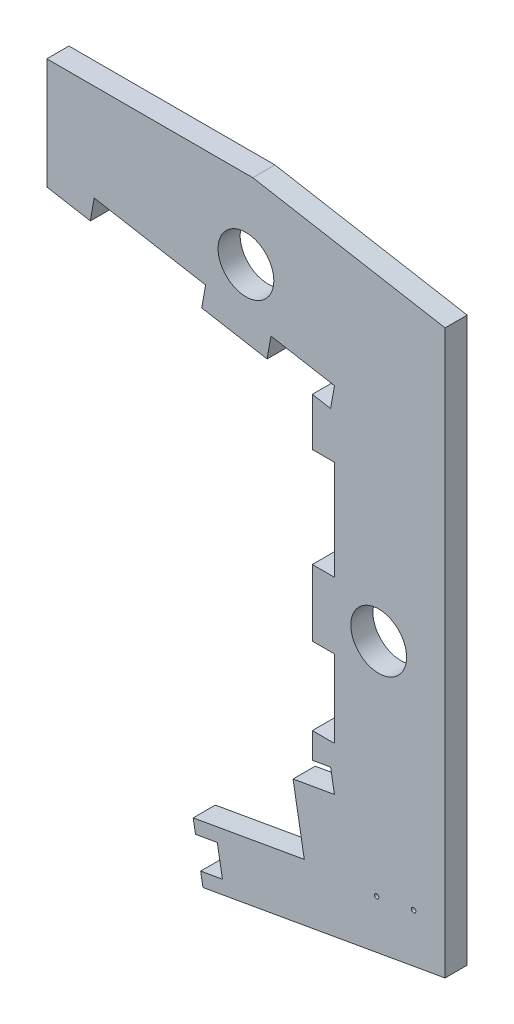
from build123d import *

# Parameters (mm, degrees)
ESQUISSE1_R             = 6.3
BOSS_EXTRU_1_DEPTH      = 5
ESQUISSE2_R             = 0.5
ENL_V_MAT_EXTRU_1_DEPTH = 5
ESQUISSE3_W             = 5
ESQUISSE3_H             = 15
BOSS_EXTRU_3_DEPTH      = 5


with BuildPart() as part:
    # Esquisse1 → Boss.-Extru.1 (new body)
    with BuildSketch(Plane.XY):
        Polygon((-65, 51.461253746), (0, 40), (0, -40), (-9.359100785, -41.650261983), (-6.809077296, -56.112163836), (-31.918247866, -60.539588071), (-29.710027076, -73.063030491), (25, -63.416176602), (25, 63.800831685), (-18.444412366, 71.461253746), (-65, 71.461253746), align=None)
        with Locations((-20, 53.680805733)):
            Circle(ESQUISSE1_R, mode=Mode.SUBTRACT)
        with Locations((10, -5)):
            Circle(ESQUISSE1_R, mode=Mode.SUBTRACT)
    extrude(amount=BOSS_EXTRU_1_DEPTH)

    # Esquisse2 → Enlèv. mat.-Extru.1 (cut)
    with BuildSketch(Plane(origin=(0, 0, 0), x_dir=(-1, 0, 0), z_dir=(0, 0, -1))):
        with Locations((-9.52419964, -55.169092692)):
            Circle(ESQUISSE2_R)
        with Locations((-17.895065541, -53.693083181)):
            Circle(ESQUISSE2_R)
        Polygon((31.396602506, -63.497985917), (30.230971609, -70.108607232), (25.306932844, -69.240366344), (26.472563741, -62.629745029), align=None)
    extrude(amount=-ENL_V_MAT_EXTRU_1_DEPTH, mode=Mode.SUBTRACT)

    # Esquisse3 → Boss.-Extru.3 (add)
    with BuildSketch(Plane.XY):
        Polygon((0, -40), (0, -30), (-5, -30), (-5, -35.804501844), (-0.868240888, -35.075961235), align=None)
        with Locations((-2.5, -5)):
            Rectangle(ESQUISSE3_W, ESQUISSE3_H)
        Polygon((-0.868240888, 35.075961235), (0, 40), (0, 25), (-5, 25), (-5, 35.804501844), align=None)
        Polygon((-29.122539924, 45.135089535), (-14.350423629, 42.53036687), (-15.218664517, 37.606328105), (-29.990780813, 40.21105077), align=None)
        Polygon((-65, 51.461253746), (-65, 46.384120687), (-55.15192247, 44.64763891), (-54.283681582, 49.571677675), align=None)
    extrude(amount=BOSS_EXTRU_3_DEPTH)


solid = part.part
